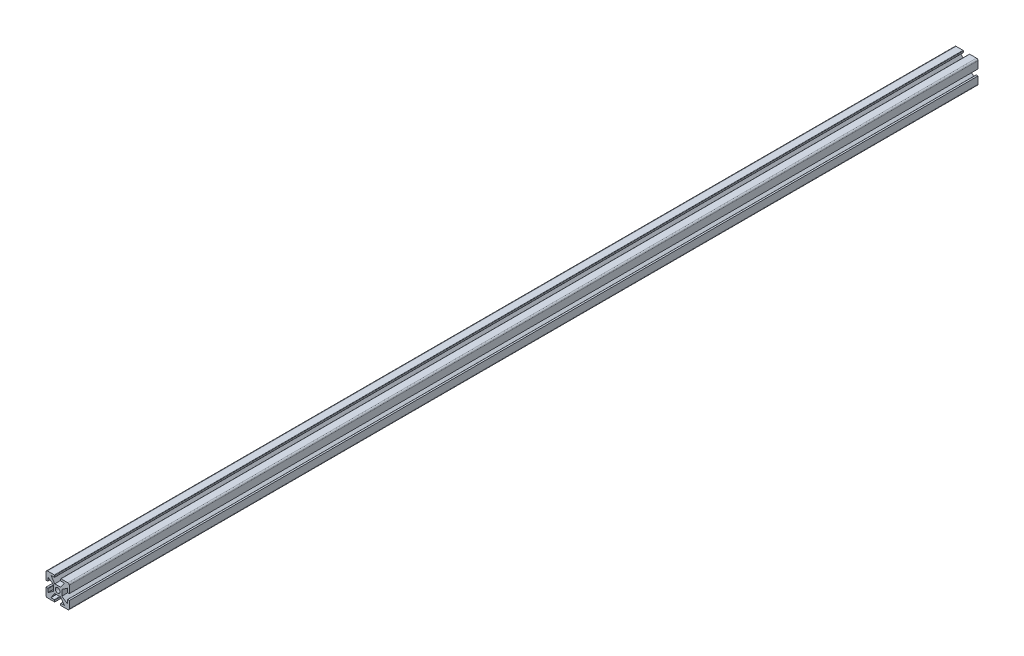
from build123d import *

# Parameters (mm, degrees)
SKETCH1_W           = 25.4
SKETCH1_H           = 25.4
BOSS_EXTRUDE1_DEPTH = 990.6
FILLET1_R           = 1.5875
HOLE1_OUTLINE_R     = 2.5527
HOLE1_DEPTH         = 990.6
SKETCH7_W           = 6.5278
SKETCH7_H           = 2.2352
CUT_EXTRUDE2_DEPTH  = 990.6
FILLET4_R           = 0.396875
CIRPATTERN2_DEPTH   = 990.6


# Read off the part's stored shape, not the designer's step: Hole1, CirPattern2
with BuildPart() as part:
    # Sketch1 → Boss-Extrude1 (new body)
    with BuildSketch(Plane.XY):
        Rectangle(SKETCH1_W, SKETCH1_H)
    extrude(amount=BOSS_EXTRUDE1_DEPTH)

    # Fillet1
    fillet1_edges = [part.edges().sort_by_distance(p)[0] for p in [
        (12.7, -12.7, 495.3),
        (-12.7, -12.7, 495.3),
        (-12.7, 12.7, 495.3),
        (12.7, 12.7, 495.3),
    ]]
    fillet(fillet1_edges, radius=FILLET1_R)

    # Hole1 outline → Hole1 (cut)
    with BuildSketch(Plane.XY):
        with Locations((0, -0.048792482)):
            Circle(HOLE1_OUTLINE_R)
    extrude(amount=HOLE1_DEPTH, mode=Mode.SUBTRACT)

    # Sketch7 → Cut-Extrude2 (cut)
    with BuildSketch(Plane.XY.offset(990.6)):
        with Locations((0, 11.5824)):
            Rectangle(SKETCH7_W, SKETCH7_H)
        Polygon((-3.175, 4.5212), (-7.3025, 10.4648), (7.3025, 10.4648), (3.175, 4.5212), align=None)
    extrude(amount=-CUT_EXTRUDE2_DEPTH, mode=Mode.SUBTRACT)

    # Fillet4
    fillet4_edges = [part.edges().sort_by_distance(p)[0] for p in [
        (-3.2639, 10.4648, 495.3),
        (-3.2639, 12.7, 495.3),
        (3.2639, 12.7, 495.3),
        (3.2639, 10.4648, 495.3),
    ]]
    fillet(fillet4_edges, radius=FILLET4_R)

    # CirPattern2 outline → CirPattern2 (cut)
    with BuildSketch(Plane.XY):
        with BuildLine():
            ThreePointArc((-3.660775, -10.562384964), (-3.380141996, -10.67862696), (-3.2639, -10.959259964))
            Line((-3.2639, -10.959259964), (-3.2639, -12.7))
            Line((-3.2639, -12.7), (3.2639, -12.7))
            Line((3.2639, -12.7), (3.2639, -10.959259964))
            ThreePointArc((3.2639, -10.959259964), (3.380141996, -10.67862696), (3.660775, -10.562384964))
            Line((3.660775, -10.562384964), (7.3025, -10.562384964))
            Line((7.3025, -10.562384964), (3.175, -4.618784964))
            Line((3.175, -4.618784964), (-3.175, -4.618784964))
            Line((-3.175, -4.618784964), (-7.3025, -10.562384964))
            Line((-7.3025, -10.562384964), (-3.660775, -10.562384964))
        make_face()
        with BuildLine():
            Line((-12.7, -3.312692482), (-10.910467482, -3.312692482))
            ThreePointArc((-10.910467482, -3.312692482), (-10.629834478, -3.428934478), (-10.513592482, -3.709567482))
            Line((-10.513592482, -3.709567482), (-10.513592482, -7.351292482))
            Line((-10.513592482, -7.351292482), (-4.569992482, -3.223792482))
            Line((-4.569992482, -3.223792482), (-4.569992482, 3.126207518))
            Line((-4.569992482, 3.126207518), (-10.513592482, 7.253707518))
            Line((-10.513592482, 7.253707518), (-10.513592482, 3.611982518))
            ThreePointArc((-10.513592482, 3.611982518), (-10.629834478, 3.331349514), (-10.910467482, 3.215107518))
            Line((-10.910467482, 3.215107518), (-12.7, 3.215107518))
            Line((-12.7, 3.215107518), (-12.7, -3.312692482))
        make_face()
        with BuildLine():
            ThreePointArc((10.513592482, -3.709567482), (10.629834478, -3.428934478), (10.910467482, -3.312692482))
            Line((10.910467482, -3.312692482), (12.7, -3.312692482))
            Line((12.7, -3.312692482), (12.7, 3.215107518))
            Line((12.7, 3.215107518), (10.910467482, 3.215107518))
            ThreePointArc((10.910467482, 3.215107518), (10.629834478, 3.331349514), (10.513592482, 3.611982518))
            Line((10.513592482, 3.611982518), (10.513592482, 7.253707518))
            Line((10.513592482, 7.253707518), (4.569992482, 3.126207518))
            Line((4.569992482, 3.126207518), (4.569992482, -3.223792482))
            Line((4.569992482, -3.223792482), (10.513592482, -7.351292482))
            Line((10.513592482, -7.351292482), (10.513592482, -3.709567482))
        make_face()
    extrude(amount=CIRPATTERN2_DEPTH, mode=Mode.SUBTRACT)


solid = part.part
